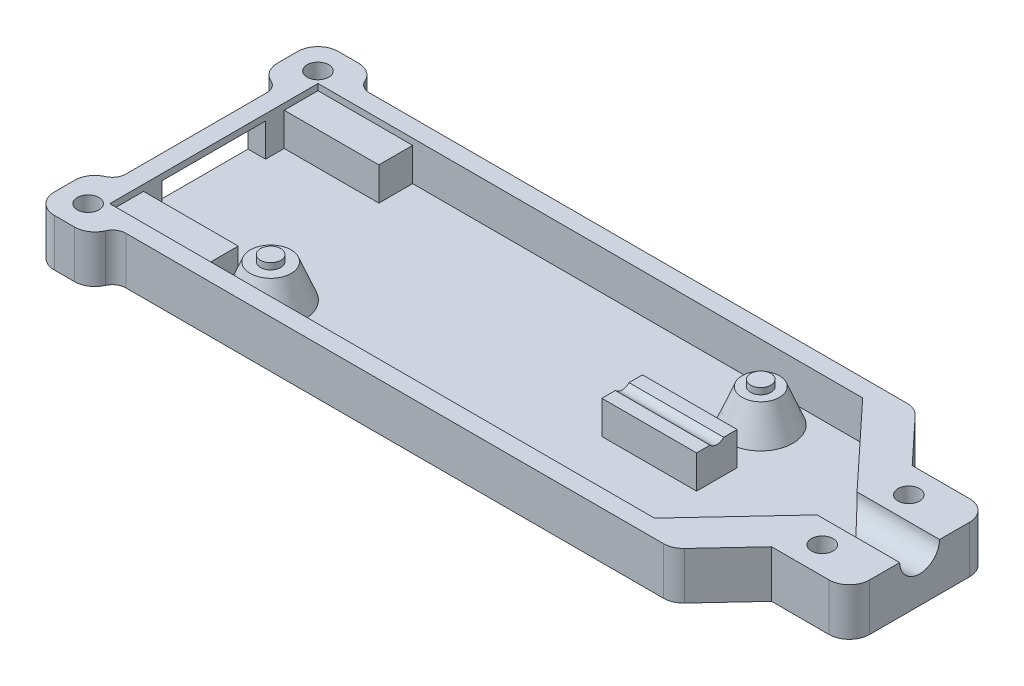
from build123d import *
from OCP.BRepFilletAPI import BRepFilletAPI_MakeChamfer

# Parameters (mm, degrees)
BOSS_EXTRUDE1_START      = -0.01
BOSS_EXTRUDE1_DEPTH      = 3.5
CUT_EXTRUDE1_DEPTH       = 2.925
SKETCH5_R                = 1.5
SKETCH5_R_2              = 1.375
SKETCH5_W                = 7
SKETCH5_H                = 2.5
SKETCH5_H_2              = 3
BOSS_EXTRUDE2_DEPTH      = 2.45
CHAMFER1_SIZE            = 1
CHAMFER1_SIZE_2          = 2.475086853
SKETCH15_R               = 0.75
BOSS_EXTRUDE5_DEPTH      = 0.465
SKETCH7_W                = 7.65
SKETCH7_H                = 2.45
CUT_EXTRUDE2_DEPTH       = 3
BOSS_EXTRUDE3_START      = 0.01
BOSS_EXTRUDE3_DEPTH      = 3.465
CUT_EXTRUDE3_DEPTH       = 2.475
SKETCH10_R               = 1.5
SKETCH10_R_2             = 1.375
BOSS_EXTRUDE4_DEPTH      = 2
CHAMFER2_SIZE            = 0.5
CHAMFER2_SIZE_2          = 2
BOSS_EXTRUDE6_START      = 2.95
SKETCH10_3_R             = 0.75
BOSS_EXTRUDE6_DEPTH      = 2.95
SKETCH21_W               = 2
SKETCH21_H               = 15.4
BOSS_EXTRUDE7_DEPTH      = 2
CUT_EXTRUDE6_START       = -3.465
SKETCH16_R               = 1
CUT_EXTRUDE6_DEPTH       = 38.860351794
SKETCH19_R               = 0.8
CUT_EXTRUDE9_DEPTH       = 35.395351794
SKETCH17_R               = 1.85
CUT_EXTRUDE7_DEPTH       = 2
SKETCH12_W               = 5
SKETCH12_H               = 4.8
CUT_EXTRUDE4_DEPTH       = 1
SKETCH13_R               = 1.475
CUT_EXTRUDE5_DEPTH       = 11.91309
CUT_EXTRUDE10_START      = -23
CUT_EXTRUDE10_DEPTH      = 9
CUT_EXTRUDE10_START_2    = -13.91308954
CUT_EXTRUDE10_2_DEPTH    = 2
CUT_EXTRUDE11_DEPTH      = 35.395351794
CUT_EXTRUDE11_DEPTH_BACK = 35.395351794
SKETCH22_W               = 1.5
SKETCH22_H               = 12
SKETCH22_W_2             = 43.847191308
SKETCH22_H_2             = 1.5
FILLET1_R                = 1.5
FILLET2_R                = 1.5
FILLET3_R                = 1
FILLET4_R                = 1


with BuildPart() as part:
    # Sketch2 → Boss-Extrude1 (new body)
    with BuildSketch(Plane(origin=(0, 0, 0), x_dir=(1, 0, 0), z_dir=(0, 1, 0)).offset(BOSS_EXTRUDE1_START)):
        Polygon((-23, 10.5), (21.303656906, 10.5), (26.250323572, 5.2), (32, 5.2), (32, -5.2), (26.250323572, -5.2), (21.303656906, -10.5), (-23, -10.5), align=None)
    extrude(amount=-BOSS_EXTRUDE1_DEPTH)

    # Sketch3 → Cut-Extrude1 (cut)
    with BuildSketch(Plane(origin=(0, 0, 0), x_dir=(1, 0, 0), z_dir=(0, 1, 0))):
        Polygon((-20.2, 7.7), (-20.2, -7.7), (20.08691046, -7.7), (27.273577127, 0), (20.08691046, 7.7), align=None)
    extrude(amount=-CUT_EXTRUDE1_DEPTH, mode=Mode.SUBTRACT)

    # Sketch5 → Boss-Extrude2 (add)
    with BuildSketch(Plane(origin=(0, -2.925, 0), x_dir=(1, 0, 0), z_dir=(0, 1, 0))):
        with Locations(Location((-11, -5, 0), (0, 0, 270))):
            Circle(SKETCH5_R)
        with Locations(Location((15.125, 5.125, 0), (0, 0, 270))):
            Circle(SKETCH5_R_2)
        with Locations((-16.7, -6.45)):
            Rectangle(SKETCH5_W, SKETCH5_H)
        with Locations((-16.7, 6.45)):
            Rectangle(SKETCH5_W, SKETCH5_H)
        with Locations((13.5, 0)):
            Rectangle(SKETCH5_W, SKETCH5_H_2)
    extrude(amount=BOSS_EXTRUDE2_DEPTH)

    # Chamfer1
    # the kernel refuses this chamfer: 2.475086853, 1 mm, written as the material it adds along each edge
    with BuildSketch(Plane(origin=(-11, -2.925, 5), x_dir=(0, 0, 1), z_dir=(-1, 0, 0))) as chamfer1_piece_1_section:
        Polygon((1.5 + CHAMFER1_SIZE, 0), (1.5, CHAMFER1_SIZE_2), (1.5, 0), align=None)
    chamfer1_piece_1 = revolve(axis=Axis((-11, -2.925, 5), (0, 1, 0)), mode=Mode.PRIVATE)
    chamfer1_piece_1 = split(chamfer1_piece_1, bisect_by=Plane(origin=(-11, -0.475, 5), z_dir=(0, -1, 0)), keep=Keep.TOP, mode=Mode.PRIVATE)
    add(chamfer1_piece_1)
    with BuildSketch(Plane(origin=(15.125, -2.925, -5.125), x_dir=(0, 0, 1), z_dir=(-1, 0, 0))) as chamfer1_piece_2_section:
        Polygon((1.375 + CHAMFER1_SIZE, 0), (1.375, CHAMFER1_SIZE_2), (1.375, 0), align=None)
    chamfer1_piece_2 = revolve(axis=Axis((15.125, -2.925, -5.125), (0, 1, 0)), mode=Mode.PRIVATE)
    chamfer1_piece_2 = split(chamfer1_piece_2, bisect_by=Plane(origin=(15.125, -0.475, -5.125), z_dir=(0, -1, 0)), keep=Keep.TOP, mode=Mode.PRIVATE)
    add(chamfer1_piece_2)

    # Sketch15 → Boss-Extrude5 (add)
    with BuildSketch(Plane(origin=(0, -0.475, 0), x_dir=(1, 0, 0), z_dir=(0, 1, 0))):
        with Locations(Location((-11, -5, 0), (0, 0, 90))):
            Circle(SKETCH15_R)
        with Locations(Location((15.125, 5.125, 0), (0, 0, 90))):
            Circle(SKETCH15_R)
    extrude(amount=BOSS_EXTRUDE5_DEPTH)

    # Sketch7 → Cut-Extrude2 (cut)
    with BuildSketch(Plane.ZY.offset(23)):
        with Locations((0, -1.7)):
            Rectangle(SKETCH7_W, SKETCH7_H)
    extrude(amount=-CUT_EXTRUDE2_DEPTH, mode=Mode.SUBTRACT)

    # Sketch19 → Cut-Extrude9 (cut, through all)
    with BuildSketch(Plane.XZ.offset(3.51)):
        with Locations(Location((-21, -8.5, 0), (0, 0, 270))):
            Circle(SKETCH19_R)
        with Locations(Location((28, -3.2, 0), (0, 0, 270))):
            Circle(SKETCH19_R)
    cut_extrude9 = extrude(amount=-CUT_EXTRUDE9_DEPTH, mode=Mode.SUBTRACT)


with BuildPart() as body_2:
    # Sketch2<2> → Boss-Extrude3 (new body)
    with BuildSketch(Plane(origin=(0, 0, 0), x_dir=(1, 0, 0), z_dir=(0, 1, 0)).offset(BOSS_EXTRUDE3_START)):
        Polygon((-23, 10.5), (21.303656906, 10.5), (26.250323572, 5.2), (32, 5.2), (32, -5.2), (26.250323572, -5.2), (21.303656906, -10.5), (-23, -10.5), align=None)
    extrude(amount=BOSS_EXTRUDE3_DEPTH)

    # Sketch3<2> → Cut-Extrude3 (cut)
    with BuildSketch(Plane(origin=(0, 0, 0), x_dir=(1, 0, 0), z_dir=(0, 1, 0))):
        Polygon((-20.2, 7.7), (-20.2, -7.7), (20.08691046, -7.7), (27.273577127, 0), (20.08691046, 7.7), align=None)
    extrude(amount=CUT_EXTRUDE3_DEPTH, mode=Mode.SUBTRACT)

    # Sketch10 → Boss-Extrude4 (add)
    with BuildSketch(Plane.XZ.offset(-2.475)):
        with Locations(Location((-11, 5, 0), (0, 0, 270))):
            Circle(SKETCH10_R)
        with Locations(Location((15.125, -5.125, 0), (0, 0, 270))):
            Circle(SKETCH10_R_2)
    extrude(amount=BOSS_EXTRUDE4_DEPTH)

    # Chamfer2
    chamfer2_edges_1 = [body_2.edges().sort_by_distance(p)[0] for p in [
        (-11, 2.475, 6.5),
    ]]
    chamfer2_side_1 = [body_2.faces().sort_by_distance(p)[0] for p in [
        (-11, 2.475, 6.51),
    ]]
    chamfer2_edges_2 = [body_2.edges().sort_by_distance(p)[0] for p in [
        (15.125, 2.475, -3.75),
    ]]
    chamfer2_side_2 = [body_2.faces().sort_by_distance(p)[0] for p in [
        (15.125, 2.475, -3.74),
    ]]
    chamfer2 = BRepFilletAPI_MakeChamfer(body_2.part.solid().wrapped)
    for e in chamfer2_edges_1:
        chamfer2.Add(CHAMFER2_SIZE - 0.0001, CHAMFER2_SIZE_2 - 0.0001, e.wrapped, chamfer2_side_1[0].wrapped)
    for e in chamfer2_edges_2:
        chamfer2.Add(CHAMFER2_SIZE - 0.0001, CHAMFER2_SIZE_2 - 0.0001, e.wrapped, chamfer2_side_2[0].wrapped)
    add(Compound.cast(chamfer2.Shape()), mode=Mode.REPLACE)  # a hair under: the kernel refuses the full size

    # Sketch10<3> → Boss-Extrude6 (add)
    with BuildSketch(Plane.XZ.offset(-2.475).offset(BOSS_EXTRUDE6_START)):
        with Locations(Location((-11, 5, 0), (0, 0, 270))):
            Circle(SKETCH10_3_R)
        with Locations(Location((15.125, -5.125, 0), (0, 0, 270))):
            Circle(SKETCH10_3_R)
    extrude(amount=-BOSS_EXTRUDE6_DEPTH)

    # Sketch21 → Boss-Extrude7 (add)
    with BuildSketch(Plane.XZ.offset(-2.475)):
        Polygon((-20.2, 7.7), (-18.2, 7.7), (-18.2, 2), (-14.2, 2), (-14.2, -2), (-18.2, -2), (-18.2, -7.7), (-20.2, -7.7), align=None)
        with Locations((19.08691046, 0)):
            Rectangle(SKETCH21_W, SKETCH21_H)
    extrude(amount=BOSS_EXTRUDE7_DEPTH)

    # Sketch16 → Cut-Extrude6 (cut)
    with BuildSketch(Plane(origin=(0, 3.475, 0), x_dir=(1, 0, 0), z_dir=(0, 1, 0)).offset(CUT_EXTRUDE6_START)):
        with Locations(Location((-21, 8.5, 0), (0, 0, 90))):
            Circle(SKETCH16_R)
        with Locations(Location((28, 3.2, 0), (0, 0, 90))):
            Circle(SKETCH16_R)
    cut_extrude6 = extrude(amount=CUT_EXTRUDE6_DEPTH, mode=Mode.SUBTRACT)

    # Sketch17 → Cut-Extrude7 (cut)
    with BuildSketch(Plane(origin=(0, 3.475, 0), x_dir=(1, 0, 0), z_dir=(0, 1, 0))):
        with Locations(Location((-21, 8.5, 0), (0, 0, 270))):
            Circle(SKETCH17_R)
        with Locations(Location((28, 3.2, 0), (0, 0, 270))):
            Circle(SKETCH17_R)
    cut_extrude7 = extrude(amount=-CUT_EXTRUDE7_DEPTH, mode=Mode.SUBTRACT)


with BuildPart() as mirror2_tool:
    # Mirror2: Cut-Extrude6, Cut-Extrude9, Cut-Extrude7 across plane
    add(cut_extrude6.mirror(Plane.XY))
    add(cut_extrude9.mirror(Plane.XY))
    add(cut_extrude7.mirror(Plane.XY))


with BuildPart() as part_1:
    add(part.part)

    # Mirror2: cut by mirror2_tool
    add(mirror2_tool.part, mode=Mode.SUBTRACT)


with BuildPart() as body_2_1:
    add(body_2.part)

    # Mirror2: cut by mirror2_tool
    add(mirror2_tool.part, mode=Mode.SUBTRACT)

    # Sketch12 → Cut-Extrude4 (cut)
    with BuildSketch(Plane(origin=(0, 3.475, 0), x_dir=(1, 0, 0), z_dir=(0, 1, 0))):
        with Locations((-9.5, -0.5)):
            Rectangle(SKETCH12_W, SKETCH12_H)
    extrude(amount=-CUT_EXTRUDE4_DEPTH, mode=Mode.SUBTRACT)


with BuildPart() as cut_extrude5_tool:
    # Sketch13 → Cut-Extrude5 (new body)
    with BuildSketch(Plane(origin=(32, 0, 0), x_dir=(0, 0, -1), z_dir=(1, 0, 0))):
        Circle(SKETCH13_R)
    extrude(amount=-CUT_EXTRUDE5_DEPTH)


with BuildPart() as part_2:
    add(part_1.part)

    # Cut-Extrude5: cut by cut_extrude5_tool
    add(cut_extrude5_tool.part, mode=Mode.SUBTRACT)

    # Cut-Extrude10: read off the stored shape, not the designer's step
    # Cut-Extrude10 outline → Cut-Extrude10 (cut)
    with BuildSketch(Plane(origin=(32, 0, 0), x_dir=(0, 0, -1), z_dir=(1, 0, 0)).offset(CUT_EXTRUDE10_START)):
        with BuildLine():
            Line((0.504752415, -0.475), (-0.504752415, -0.475))
            ThreePointArc((-0.504752415, -0.475), (0, -0.69), (0.504752415, -0.475))
        make_face()
    extrude(amount=CUT_EXTRUDE10_DEPTH, mode=Mode.SUBTRACT)


with BuildPart() as body_2_2:
    add(body_2_1.part)

    # Cut-Extrude5: cut by cut_extrude5_tool
    add(cut_extrude5_tool.part, mode=Mode.SUBTRACT)

    # Cut-Extrude10 2 outline → Cut-Extrude10 2 (cut)
    with BuildSketch(Plane(origin=(32, 0, 0), x_dir=(0, 0, -1), z_dir=(1, 0, 0)).offset(CUT_EXTRUDE10_START_2)):
        with BuildLine():
            Line((-0.523235129, 0.475), (0.523235129, 0.475))
            ThreePointArc((0.523235129, 0.475), (0, 0.71), (-0.523235129, 0.475))
        make_face()
    extrude(amount=CUT_EXTRUDE10_2_DEPTH, mode=Mode.SUBTRACT)


with BuildPart() as cut_extrude11_tool:
    # Sketch22 → Cut-Extrude11 (new, two sides: drawn at the far end of the back side and taken through both)
    with BuildSketch(Plane(origin=(0, 3.475, 0), x_dir=(1, 0, 0), z_dir=(0, 1, 0)).offset(-CUT_EXTRUDE11_DEPTH_BACK)):
        with Locations((-22.25, 0)):
            Rectangle(SKETCH22_W, SKETCH22_H)
        with Locations((3.423595654, 9.75)):
            Rectangle(SKETCH22_W_2, SKETCH22_H_2)
        with Locations((3.423595654, -9.75)):
            Rectangle(SKETCH22_W_2, SKETCH22_H_2)
    extrude(amount=CUT_EXTRUDE11_DEPTH + CUT_EXTRUDE11_DEPTH_BACK)


with BuildPart() as part_3:
    add(part_2.part)

    # Cut-Extrude11: cut by cut_extrude11_tool
    add(cut_extrude11_tool.part, mode=Mode.SUBTRACT)

    # Fillet2
    fillet2_edges = [part_3.edges().sort_by_distance(p)[0] for p in [
        (-18.5, -1.76, -10.5),
        (-18.5, -1.76, 10.5),
        (-23, -1.76, -6),
        (-23, -1.76, 10.5),
        (32, -1.76, 5.2),
        (-23, -1.76, 6),
        (-23, -1.76, -10.5),
        (32, -1.76, -5.2),
        (22.703656906, -1.76, 9),
        (22.703656906, -1.76, -9),
    ]]
    fillet(fillet2_edges, radius=FILLET2_R - 0.0001)  # a hair under: the kernel refuses the full size

    # Fillet4
    fillet4_edges = [part_3.edges().sort_by_distance(p)[0] for p in [
        (-21.5, -1.76, 6),
        (-21.5, -1.76, -6),
        (-18.5, -1.76, -9),
        (-18.5, -1.76, 9),
    ]]
    fillet(fillet4_edges, radius=FILLET4_R)


with BuildPart() as body_2_3:
    add(body_2_2.part)

    # Cut-Extrude11: cut by cut_extrude11_tool
    add(cut_extrude11_tool.part, mode=Mode.SUBTRACT)

    # Fillet1
    fillet1_edges = [body_2_3.edges().sort_by_distance(p)[0] for p in [
        (-23, 1.7425, -10.5),
        (-23, 1.7425, -6),
        (32, 1.7425, -5.2),
        (32, 1.7425, 5.2),
        (-18.5, 1.7425, 10.5),
        (-23, 1.7425, 6),
        (-23, 1.7425, 10.5),
        (-18.5, 1.7425, -10.5),
        (22.703656906, 1.7425, -9),
        (22.703656906, 1.7425, 9),
    ]]
    fillet(fillet1_edges, radius=FILLET1_R - 0.0001)  # a hair under: the kernel refuses the full size

    # Fillet3
    fillet3_edges = [body_2_3.edges().sort_by_distance(p)[0] for p in [
        (-21.5, 1.7425, -6),
        (-21.5, 1.7425, 6),
        (-18.5, 1.7425, -9),
        (-18.5, 1.7425, 9),
    ]]
    fillet(fillet3_edges, radius=FILLET3_R)


solid = part_3.part
